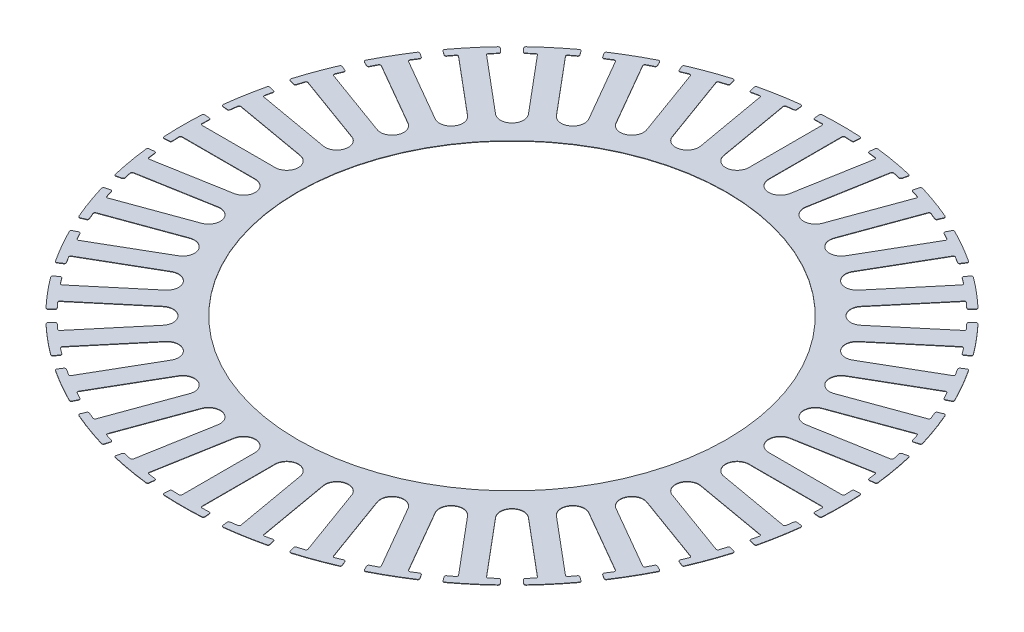
from build123d import *

# Parameters (mm, degrees)
P_IDAT_VYSUNUT_M1_DEPTH = 0.05
ZAOBLIT1_R              = 0.2
KRUHOV_POLE1_DEPTH      = 0.05


# Read off the part's stored shape, not the designer's step: Kruhové pole1
with BuildPart() as part:
    # Skica1 → Přidat vysunutím1 (new body)
    with BuildSketch(Plane(origin=(0, 0, 0), x_dir=(1, 0, 0), z_dir=(0, 1, 0))):
        with BuildLine():
            Line((-2.569801004, 41.420358796), (-2.507878089, 40.422277861))
            ThreePointArc((-2.507878089, 40.422277861), (-1.879166138, 40.456380642), (-1.25, 40.48070528))
            Line((-1.25, 40.48070528), (-1.25, 31.073947021))
            Line((-1.25, 31.073947021), (-1.085241159, 26.978181029))
            ThreePointArc((-1.085241159, 26.978181029), (1.270191917, 26.970105904), (3.615958065, 26.756771989))
            Line((3.615958065, 26.756771989), (4.164924582, 30.818924165))
            ThreePointArc((4.164924582, 30.818924165), (2.590619594, 29.610917461), (1.25, 31.073947021))
            Line((1.25, 31.073947021), (1.25, 40.48070528))
            ThreePointArc((1.25, 40.48070528), (1.879166138, 40.456380642), (2.507878089, 40.422277861))
            Line((2.507878089, 40.422277861), (2.569801004, 41.420358796))
            ThreePointArc((2.569801004, 41.420358796), (0, 41.5), (-2.569801004, 41.420358796))
        make_face()
    extrude(amount=P_IDAT_VYSUNUT_M1_DEPTH)

    # Zaoblit1
    zaoblit1_edges = [part.edges().sort_by_distance(p)[0] for p in [
        (-2.507878089, 0.025, -40.422277861),
        (-2.569801004, 0.025, -41.420358796),
        (2.569801004, 0.025, -41.420358796),
        (2.507878089, 0.025, -40.422277861),
        (1.25, 0.025, -40.48070528),
        (-1.25, 0.025, -40.48070528),
    ]]
    fillet(zaoblit1_edges, radius=ZAOBLIT1_R)

    # Kruhové pole1 outline → Kruhové pole1 (add)
    with BuildSketch(Plane(origin=(0, 0, 0), x_dir=(1, 0, 0), z_dir=(0, 1, 0))):
        with BuildLine():
            ThreePointArc((-9.535776959, 39.566639455), (-9.446113134, 39.443136268), (-9.295440541, 39.418837948))
            ThreePointArc((-9.295440541, 39.418837948), (-8.879840332, 39.514534486), (-8.463255471, 39.605849402))
            ThreePointArc((-8.463255471, 39.605849402), (-8.309712699, 39.576132918), (-8.224500066, 39.444994596))
            Line((-8.224500066, 39.444994596), (-6.626943964, 30.384803721))
            ThreePointArc((-6.626943964, 30.384803721), (-7.693144117, 28.711204717), (-9.453300038, 29.627483893))
            Line((-9.453300038, 29.627483893), (-12.599871307, 38.272617405))
            ThreePointArc((-12.599871307, 38.272617405), (-12.591644164, 38.42879284), (-12.473530464, 38.531299456))
            ThreePointArc((-12.473530464, 38.531299456), (-12.067099933, 38.66051085), (-11.659331326, 38.785435321))
            ThreePointArc((-11.659331326, 38.785435321), (-11.540994193, 38.88181458), (-11.525094636, 39.03360339))
            Line((-11.525094636, 39.03360339), (-11.695001824, 39.609051142))
            ThreePointArc((-11.695001824, 39.609051142), (-11.791655425, 39.728326768), (-11.94437873, 39.74395321))
            ThreePointArc((-11.94437873, 39.74395321), (-14.193835948, 38.997243763), (-16.396995731, 38.123333157))
            ThreePointArc((-16.396995731, 38.123333157), (-16.503944086, 38.01319396), (-16.501316146, 37.859695792))
            Line((-16.501316146, 37.859695792), (-16.261581918, 37.309663005))
            ThreePointArc((-16.261581918, 37.309663005), (-16.151834185, 37.203606068), (-15.999231288, 37.205840915))
            ThreePointArc((-15.999231288, 37.205840915), (-15.60656251, 37.372251827), (-15.212163177, 37.534518666))
            ThreePointArc((-15.212163177, 37.534518666), (-15.055792851, 37.531916065), (-14.949102859, 37.417567047))
            Line((-14.949102859, 37.417567047), (-11.80253159, 28.772433535))
            ThreePointArc((-11.80253159, 28.772433535), (-12.56191635, 26.939116547), (-14.454441756, 27.535827516))
            Line((-14.454441756, 27.535827516), (-19.054421217, 35.503225657))
            ThreePointArc((-19.054421217, 35.503225657), (-19.073438642, 35.658457064), (-18.974919442, 35.779916603))
            ThreePointArc((-18.974919442, 35.779916603), (-18.597100828, 35.977740907), (-18.217220048, 36.17157577))
            ThreePointArc((-18.217220048, 36.17157577), (-18.117416804, 36.28703984), (-18.128116648, 36.439283566))
            Line((-18.128116648, 36.439283566), (-18.395368018, 36.976484899))
            ThreePointArc((-18.395368018, 36.976484899), (-18.511265228, 37.077164739), (-18.664381826, 37.066033657))
            ThreePointArc((-18.664381826, 37.066033657), (-20.75, 35.940054257), (-22.767935851, 34.696845636))
            ThreePointArc((-22.767935851, 34.696845636), (-22.85413395, 34.569808313), (-22.824891256, 34.419098465))
            Line((-22.824891256, 34.419098465), (-22.493286939, 33.919051323))
            ThreePointArc((-22.493286939, 33.919051323), (-22.366789927, 33.833663123), (-22.216893488, 33.862363233))
            ThreePointArc((-22.216893488, 33.862363233), (-21.859087183, 34.094432207), (-21.498857003, 34.322720574))
            ThreePointArc((-21.498857003, 34.322720574), (-21.344410357, 34.347310934), (-21.219484727, 34.253225657))
            Line((-21.219484727, 34.253225657), (-16.619505265, 26.285827516))
            ThreePointArc((-16.619505265, 26.285827516), (-17.049001111, 24.348496953), (-19.016392575, 24.607508953))
            Line((-19.016392575, 24.607508953), (-24.930012181, 31.655086363))
            ThreePointArc((-24.930012181, 31.655086363), (-24.975696339, 31.804657116), (-24.899765095, 31.941379091))
            ThreePointArc((-24.899765095, 31.941379091), (-24.562038224, 32.201805513), (-24.221587758, 32.458661194))
            ThreePointArc((-24.221587758, 32.458661194), (-24.143350875, 32.589701756), (-24.180325009, 32.737774549))
            Line((-24.180325009, 32.737774549), (-24.536800263, 33.220406874))
            ThreePointArc((-24.536800263, 33.220406874), (-24.668419605, 33.299431821), (-24.817277126, 33.261881427))
            ThreePointArc((-24.817277126, 33.261881427), (-26.675685802, 31.790844389), (-28.447083762, 30.216112018))
            ThreePointArc((-28.447083762, 30.216112018), (-28.509912518, 30.076036535), (-28.454943596, 29.932694248))
            Line((-28.454943596, 29.932694248), (-28.041544819, 29.497826431))
            ThreePointArc((-28.041544819, 29.497826431), (-27.902142075, 29.435701446), (-27.759506622, 29.48999478))
            ThreePointArc((-27.759506622, 29.48999478), (-27.447434553, 29.780670518), (-27.132318937, 30.068043985))
            ThreePointArc((-27.132318937, 30.068043985), (-26.984488754, 30.119080141), (-26.845123288, 30.048117339))
            Line((-26.845123288, 30.048117339), (-20.931503683, 23.000539929))
            ThreePointArc((-20.931503683, 23.000539929), (-21.0180606, 21.0180606), (-23.000539929, 20.931503683))
            Line((-23.000539929, 20.931503683), (-30.048117339, 26.845123288))
            ThreePointArc((-30.048117339, 26.845123288), (-30.119080141, 26.984488754), (-30.068043985, 27.132318937))
            ThreePointArc((-30.068043985, 27.132318937), (-29.780670518, 27.447434553), (-29.48999478, 27.759506622))
            ThreePointArc((-29.48999478, 27.759506622), (-29.435701446, 27.902142075), (-29.497826431, 28.041544819))
            Line((-29.497826431, 28.041544819), (-29.932694248, 28.454943596))
            ThreePointArc((-29.932694248, 28.454943596), (-30.076036535, 28.509912518), (-30.216112018, 28.447083762))
            ThreePointArc((-30.216112018, 28.447083762), (-31.790844389, 26.675685802), (-33.261881427, 24.817277126))
            ThreePointArc((-33.261881427, 24.817277126), (-33.299431821, 24.668419605), (-33.220406874, 24.536800263))
            Line((-33.220406874, 24.536800263), (-32.737774549, 24.180325009))
            ThreePointArc((-32.737774549, 24.180325009), (-32.589701756, 24.143350875), (-32.458661194, 24.221587758))
            ThreePointArc((-32.458661194, 24.221587758), (-32.201805513, 24.562038224), (-31.941379091, 24.899765095))
            ThreePointArc((-31.941379091, 24.899765095), (-31.804657116, 24.975696339), (-31.655086363, 24.930012181))
            Line((-31.655086363, 24.930012181), (-24.607508953, 19.016392575))
            ThreePointArc((-24.607508953, 19.016392575), (-24.348496953, 17.049001111), (-26.285827516, 16.619505265))
            Line((-26.285827516, 16.619505265), (-34.253225657, 21.219484727))
            ThreePointArc((-34.253225657, 21.219484727), (-34.347310934, 21.344410357), (-34.322720574, 21.498857003))
            ThreePointArc((-34.322720574, 21.498857003), (-34.094432207, 21.859087183), (-33.862363233, 22.216893488))
            ThreePointArc((-33.862363233, 22.216893488), (-33.833663123, 22.366789927), (-33.919051323, 22.493286939))
            Line((-33.919051323, 22.493286939), (-34.419098465, 22.824891256))
            ThreePointArc((-34.419098465, 22.824891256), (-34.569808313, 22.85413395), (-34.696845636, 22.767935851))
            ThreePointArc((-34.696845636, 22.767935851), (-35.940054257, 20.75), (-37.066033657, 18.664381826))
            ThreePointArc((-37.066033657, 18.664381826), (-37.077164739, 18.511265228), (-36.976484899, 18.395368018))
            Line((-36.976484899, 18.395368018), (-36.439283566, 18.128116648))
            ThreePointArc((-36.439283566, 18.128116648), (-36.28703984, 18.117416804), (-36.17157577, 18.217220048))
            ThreePointArc((-36.17157577, 18.217220048), (-35.977740907, 18.597100828), (-35.779916603, 18.974919442))
            ThreePointArc((-35.779916603, 18.974919442), (-35.658457064, 19.073438642), (-35.503225657, 19.054421217))
            Line((-35.503225657, 19.054421217), (-27.535827516, 14.454441756))
            ThreePointArc((-27.535827516, 14.454441756), (-26.939116547, 12.56191635), (-28.772433535, 11.80253159))
            Line((-28.772433535, 11.80253159), (-37.417567047, 14.949102859))
            ThreePointArc((-37.417567047, 14.949102859), (-37.531916065, 15.055792851), (-37.534518666, 15.212163177))
            ThreePointArc((-37.534518666, 15.212163177), (-37.372251827, 15.60656251), (-37.205840915, 15.999231288))
            ThreePointArc((-37.205840915, 15.999231288), (-37.203606068, 16.151834185), (-37.309663005, 16.261581918))
            Line((-37.309663005, 16.261581918), (-37.859695792, 16.501316146))
            ThreePointArc((-37.859695792, 16.501316146), (-38.01319396, 16.503944086), (-38.123333157, 16.396995731))
            ThreePointArc((-38.123333157, 16.396995731), (-38.997243763, 14.193835948), (-39.74395321, 11.94437873))
            ThreePointArc((-39.74395321, 11.94437873), (-39.728326768, 11.791655425), (-39.609051142, 11.695001824))
            Line((-39.609051142, 11.695001824), (-39.03360339, 11.525094636))
            ThreePointArc((-39.03360339, 11.525094636), (-38.88181458, 11.540994193), (-38.785435321, 11.659331326))
            ThreePointArc((-38.785435321, 11.659331326), (-38.66051085, 12.067099933), (-38.531299456, 12.473530464))
            ThreePointArc((-38.531299456, 12.473530464), (-38.42879284, 12.591644164), (-38.272617405, 12.599871307))
            Line((-38.272617405, 12.599871307), (-29.627483893, 9.453300038))
            ThreePointArc((-29.627483893, 9.453300038), (-28.711204717, 7.693144117), (-30.384803721, 6.626943964))
            Line((-30.384803721, 6.626943964), (-39.444994596, 8.224500066))
            ThreePointArc((-39.444994596, 8.224500066), (-39.576132918, 8.309712699), (-39.605849402, 8.463255471))
            ThreePointArc((-39.605849402, 8.463255471), (-39.514534486, 8.879840332), (-39.418837948, 9.295440541))
            ThreePointArc((-39.418837948, 9.295440541), (-39.443136268, 9.446113134), (-39.566639455, 9.535776959))
            Line((-39.566639455, 9.535776959), (-40.14994542, 9.676356894))
            ThreePointArc((-40.14994542, 9.676356894), (-40.301567943, 9.652290233), (-40.391462492, 9.527841192))
            ThreePointArc((-40.391462492, 9.527841192), (-40.86952175, 7.206399373), (-41.214272856, 4.86145173))
            ThreePointArc((-41.214272856, 4.86145173), (-41.172363691, 4.713762138), (-41.038116408, 4.639288918))
            Line((-41.038116408, 4.639288918), (-40.441906928, 4.571888455))
            ThreePointArc((-40.441906928, 4.571888455), (-40.29518506, 4.613904312), (-40.220819046, 4.747179721))
            ThreePointArc((-40.220819046, 4.747179721), (-40.168600734, 5.170446314), (-40.111928272, 5.593139575))
            ThreePointArc((-40.111928272, 5.593139575), (-40.03148919, 5.727258949), (-39.87911504, 5.762480683))
            Line((-39.87911504, 5.762480683), (-30.818924165, 4.164924582))
            ThreePointArc((-30.818924165, 4.164924582), (-29.610917461, 2.590619594), (-31.073947021, 1.25))
            Line((-31.073947021, 1.25), (-40.273905944, 1.25))
            ThreePointArc((-40.273905944, 1.25), (-40.417848999, 1.311146131), (-40.473776445, 1.45719603))
            ThreePointArc((-40.473776445, 1.45719603), (-40.45618801, 1.8833087), (-40.434113536, 2.309212537))
            ThreePointArc((-40.434113536, 2.309212537), (-40.484206732, 2.453376716), (-40.621403588, 2.520232243))
            Line((-40.621403588, 2.520232243), (-41.220259274, 2.557386434))
            ThreePointArc((-41.220259274, 2.557386434), (-41.365399178, 2.507356425), (-41.432317677, 2.369188021))
            ThreePointArc((-41.432317677, 2.369188021), (-41.5, 0), (-41.432317677, -2.369188021))
            ThreePointArc((-41.432317677, -2.369188021), (-41.365399178, -2.507356425), (-41.220259274, -2.557386434))
            Line((-41.220259274, -2.557386434), (-40.621403588, -2.520232243))
            ThreePointArc((-40.621403588, -2.520232243), (-40.484206732, -2.453376716), (-40.434113536, -2.309212537))
            ThreePointArc((-40.434113536, -2.309212537), (-40.45618801, -1.8833087), (-40.473776445, -1.45719603))
            ThreePointArc((-40.473776445, -1.45719603), (-40.417848999, -1.311146131), (-40.273905944, -1.25))
            Line((-40.273905944, -1.25), (-31.073947021, -1.25))
            ThreePointArc((-31.073947021, -1.25), (-29.610917461, -2.590619594), (-30.818924165, -4.164924582))
            Line((-30.818924165, -4.164924582), (-39.87911504, -5.762480683))
            ThreePointArc((-39.87911504, -5.762480683), (-40.03148919, -5.727258949), (-40.111928272, -5.593139575))
            ThreePointArc((-40.111928272, -5.593139575), (-40.168600734, -5.170446314), (-40.220819046, -4.747179721))
            ThreePointArc((-40.220819046, -4.747179721), (-40.29518506, -4.613904312), (-40.441906928, -4.571888455))
            Line((-40.441906928, -4.571888455), (-41.038116408, -4.639288918))
            ThreePointArc((-41.038116408, -4.639288918), (-41.172363691, -4.713762138), (-41.214272856, -4.86145173))
            ThreePointArc((-41.214272856, -4.86145173), (-40.86952175, -7.206399373), (-40.391462492, -9.527841192))
            ThreePointArc((-40.391462492, -9.527841192), (-40.301567943, -9.652290233), (-40.14994542, -9.676356894))
            Line((-40.14994542, -9.676356894), (-39.566639455, -9.535776959))
            ThreePointArc((-39.566639455, -9.535776959), (-39.443136268, -9.446113134), (-39.418837948, -9.295440541))
            ThreePointArc((-39.418837948, -9.295440541), (-39.514534486, -8.879840332), (-39.605849402, -8.463255471))
            ThreePointArc((-39.605849402, -8.463255471), (-39.576132918, -8.309712699), (-39.444994596, -8.224500066))
            Line((-39.444994596, -8.224500066), (-30.384803721, -6.626943964))
            ThreePointArc((-30.384803721, -6.626943964), (-28.711204717, -7.693144117), (-29.627483893, -9.453300038))
            Line((-29.627483893, -9.453300038), (-38.272617405, -12.599871307))
            ThreePointArc((-38.272617405, -12.599871307), (-38.42879284, -12.591644164), (-38.531299456, -12.473530464))
            ThreePointArc((-38.531299456, -12.473530464), (-38.66051085, -12.067099933), (-38.785435321, -11.659331326))
            ThreePointArc((-38.785435321, -11.659331326), (-38.88181458, -11.540994193), (-39.03360339, -11.525094636))
            Line((-39.03360339, -11.525094636), (-39.609051142, -11.695001824))
            ThreePointArc((-39.609051142, -11.695001824), (-39.728326768, -11.791655425), (-39.74395321, -11.94437873))
            ThreePointArc((-39.74395321, -11.94437873), (-38.997243763, -14.193835948), (-38.123333157, -16.396995731))
            ThreePointArc((-38.123333157, -16.396995731), (-38.01319396, -16.503944086), (-37.859695792, -16.501316146))
            Line((-37.859695792, -16.501316146), (-37.309663005, -16.261581918))
            ThreePointArc((-37.309663005, -16.261581918), (-37.203606068, -16.151834185), (-37.205840915, -15.999231288))
            ThreePointArc((-37.205840915, -15.999231288), (-37.372251827, -15.60656251), (-37.534518666, -15.212163177))
            ThreePointArc((-37.534518666, -15.212163177), (-37.531916065, -15.055792851), (-37.417567047, -14.949102859))
            Line((-37.417567047, -14.949102859), (-28.772433535, -11.80253159))
            ThreePointArc((-28.772433535, -11.80253159), (-26.939116547, -12.56191635), (-27.535827516, -14.454441756))
            Line((-27.535827516, -14.454441756), (-35.503225657, -19.054421217))
            ThreePointArc((-35.503225657, -19.054421217), (-35.658457064, -19.073438642), (-35.779916603, -18.974919442))
            ThreePointArc((-35.779916603, -18.974919442), (-35.977740907, -18.597100828), (-36.17157577, -18.217220048))
            ThreePointArc((-36.17157577, -18.217220048), (-36.28703984, -18.117416804), (-36.439283566, -18.128116648))
            Line((-36.439283566, -18.128116648), (-36.976484899, -18.395368018))
            ThreePointArc((-36.976484899, -18.395368018), (-37.077164739, -18.511265228), (-37.066033657, -18.664381826))
            ThreePointArc((-37.066033657, -18.664381826), (-35.940054257, -20.75), (-34.696845636, -22.767935851))
            ThreePointArc((-34.696845636, -22.767935851), (-34.569808313, -22.85413395), (-34.419098465, -22.824891256))
            Line((-34.419098465, -22.824891256), (-33.919051323, -22.493286939))
            ThreePointArc((-33.919051323, -22.493286939), (-33.833663123, -22.366789927), (-33.862363233, -22.216893488))
            ThreePointArc((-33.862363233, -22.216893488), (-34.094432207, -21.859087183), (-34.322720574, -21.498857003))
            ThreePointArc((-34.322720574, -21.498857003), (-34.347310934, -21.344410357), (-34.253225657, -21.219484727))
            Line((-34.253225657, -21.219484727), (-26.285827516, -16.619505265))
            ThreePointArc((-26.285827516, -16.619505265), (-24.348496953, -17.049001111), (-24.607508953, -19.016392575))
            Line((-24.607508953, -19.016392575), (-31.655086363, -24.930012181))
            ThreePointArc((-31.655086363, -24.930012181), (-31.804657116, -24.975696339), (-31.941379091, -24.899765095))
            ThreePointArc((-31.941379091, -24.899765095), (-32.201805513, -24.562038224), (-32.458661194, -24.221587758))
            ThreePointArc((-32.458661194, -24.221587758), (-32.589701756, -24.143350875), (-32.737774549, -24.180325009))
            Line((-32.737774549, -24.180325009), (-33.220406874, -24.536800263))
            ThreePointArc((-33.220406874, -24.536800263), (-33.299431821, -24.668419605), (-33.261881427, -24.817277126))
            ThreePointArc((-33.261881427, -24.817277126), (-31.790844389, -26.675685802), (-30.216112018, -28.447083762))
            ThreePointArc((-30.216112018, -28.447083762), (-30.076036535, -28.509912518), (-29.932694248, -28.454943596))
            Line((-29.932694248, -28.454943596), (-29.497826431, -28.041544819))
            ThreePointArc((-29.497826431, -28.041544819), (-29.435701446, -27.902142075), (-29.48999478, -27.759506622))
            ThreePointArc((-29.48999478, -27.759506622), (-29.780670518, -27.447434553), (-30.068043985, -27.132318937))
            ThreePointArc((-30.068043985, -27.132318937), (-30.119080141, -26.984488754), (-30.048117339, -26.845123288))
            Line((-30.048117339, -26.845123288), (-23.000539929, -20.931503683))
            ThreePointArc((-23.000539929, -20.931503683), (-21.0180606, -21.0180606), (-20.931503683, -23.000539929))
            Line((-20.931503683, -23.000539929), (-26.845123288, -30.048117339))
            ThreePointArc((-26.845123288, -30.048117339), (-26.984488754, -30.119080141), (-27.132318937, -30.068043985))
            ThreePointArc((-27.132318937, -30.068043985), (-27.447434553, -29.780670518), (-27.759506622, -29.48999478))
            ThreePointArc((-27.759506622, -29.48999478), (-27.902142075, -29.435701446), (-28.041544819, -29.497826431))
            Line((-28.041544819, -29.497826431), (-28.454943596, -29.932694248))
            ThreePointArc((-28.454943596, -29.932694248), (-28.509912518, -30.076036535), (-28.447083762, -30.216112018))
            ThreePointArc((-28.447083762, -30.216112018), (-26.675685802, -31.790844389), (-24.817277126, -33.261881427))
            ThreePointArc((-24.817277126, -33.261881427), (-24.668419605, -33.299431821), (-24.536800263, -33.220406874))
            Line((-24.536800263, -33.220406874), (-24.180325009, -32.737774549))
            ThreePointArc((-24.180325009, -32.737774549), (-24.143350875, -32.589701756), (-24.221587758, -32.458661194))
            ThreePointArc((-24.221587758, -32.458661194), (-24.562038224, -32.201805513), (-24.899765095, -31.941379091))
            ThreePointArc((-24.899765095, -31.941379091), (-24.975696339, -31.804657116), (-24.930012181, -31.655086363))
            Line((-24.930012181, -31.655086363), (-19.016392575, -24.607508953))
            ThreePointArc((-19.016392575, -24.607508953), (-17.049001111, -24.348496953), (-16.619505265, -26.285827516))
            Line((-16.619505265, -26.285827516), (-21.219484727, -34.253225657))
            ThreePointArc((-21.219484727, -34.253225657), (-21.344410357, -34.347310934), (-21.498857003, -34.322720574))
            ThreePointArc((-21.498857003, -34.322720574), (-21.859087183, -34.094432207), (-22.216893488, -33.862363233))
            ThreePointArc((-22.216893488, -33.862363233), (-22.366789927, -33.833663123), (-22.493286939, -33.919051323))
            Line((-22.493286939, -33.919051323), (-22.824891256, -34.419098465))
            ThreePointArc((-22.824891256, -34.419098465), (-22.85413395, -34.569808313), (-22.767935851, -34.696845636))
            ThreePointArc((-22.767935851, -34.696845636), (-20.75, -35.940054257), (-18.664381826, -37.066033657))
            ThreePointArc((-18.664381826, -37.066033657), (-18.511265228, -37.077164739), (-18.395368018, -36.976484899))
            Line((-18.395368018, -36.976484899), (-18.128116648, -36.439283566))
            ThreePointArc((-18.128116648, -36.439283566), (-18.117416804, -36.28703984), (-18.217220048, -36.17157577))
            ThreePointArc((-18.217220048, -36.17157577), (-18.597100828, -35.977740907), (-18.974919442, -35.779916603))
            ThreePointArc((-18.974919442, -35.779916603), (-19.073438642, -35.658457064), (-19.054421217, -35.503225657))
            Line((-19.054421217, -35.503225657), (-14.454441756, -27.535827516))
            ThreePointArc((-14.454441756, -27.535827516), (-12.56191635, -26.939116547), (-11.80253159, -28.772433535))
            Line((-11.80253159, -28.772433535), (-14.949102859, -37.417567047))
            ThreePointArc((-14.949102859, -37.417567047), (-15.055792851, -37.531916065), (-15.212163177, -37.534518666))
            ThreePointArc((-15.212163177, -37.534518666), (-15.60656251, -37.372251827), (-15.999231288, -37.205840915))
            ThreePointArc((-15.999231288, -37.205840915), (-16.151834185, -37.203606068), (-16.261581918, -37.309663005))
            Line((-16.261581918, -37.309663005), (-16.501316146, -37.859695792))
            ThreePointArc((-16.501316146, -37.859695792), (-16.503944086, -38.01319396), (-16.396995731, -38.123333157))
            ThreePointArc((-16.396995731, -38.123333157), (-14.193835948, -38.997243763), (-11.94437873, -39.74395321))
            ThreePointArc((-11.94437873, -39.74395321), (-11.791655425, -39.728326768), (-11.695001824, -39.609051142))
            Line((-11.695001824, -39.609051142), (-11.525094636, -39.03360339))
            ThreePointArc((-11.525094636, -39.03360339), (-11.540994193, -38.88181458), (-11.659331326, -38.785435321))
            ThreePointArc((-11.659331326, -38.785435321), (-12.067099933, -38.66051085), (-12.473530464, -38.531299456))
            ThreePointArc((-12.473530464, -38.531299456), (-12.591644164, -38.42879284), (-12.599871307, -38.272617405))
            Line((-12.599871307, -38.272617405), (-9.453300038, -29.627483893))
            ThreePointArc((-9.453300038, -29.627483893), (-7.693144117, -28.711204717), (-6.626943964, -30.384803721))
            Line((-6.626943964, -30.384803721), (-8.224500066, -39.444994596))
            ThreePointArc((-8.224500066, -39.444994596), (-8.309712699, -39.576132918), (-8.463255471, -39.605849402))
            ThreePointArc((-8.463255471, -39.605849402), (-8.879840332, -39.514534486), (-9.295440541, -39.418837948))
            ThreePointArc((-9.295440541, -39.418837948), (-9.446113134, -39.443136268), (-9.535776959, -39.566639455))
            Line((-9.535776959, -39.566639455), (-9.676356894, -40.14994542))
            ThreePointArc((-9.676356894, -40.14994542), (-9.652290233, -40.301567943), (-9.527841192, -40.391462492))
            ThreePointArc((-9.527841192, -40.391462492), (-7.206399373, -40.86952175), (-4.86145173, -41.214272856))
            ThreePointArc((-4.86145173, -41.214272856), (-4.713762138, -41.172363691), (-4.639288918, -41.038116408))
            Line((-4.639288918, -41.038116408), (-4.571888455, -40.441906928))
            ThreePointArc((-4.571888455, -40.441906928), (-4.613904312, -40.29518506), (-4.747179721, -40.220819046))
            ThreePointArc((-4.747179721, -40.220819046), (-5.170446314, -40.168600734), (-5.593139575, -40.111928272))
            ThreePointArc((-5.593139575, -40.111928272), (-5.727258949, -40.03148919), (-5.762480683, -39.87911504))
            Line((-5.762480683, -39.87911504), (-4.164924582, -30.818924165))
            ThreePointArc((-4.164924582, -30.818924165), (-2.590619594, -29.610917461), (-1.25, -31.073947021))
            Line((-1.25, -31.073947021), (-1.25, -40.273905944))
            ThreePointArc((-1.25, -40.273905944), (-1.311146131, -40.417848999), (-1.45719603, -40.473776445))
            ThreePointArc((-1.45719603, -40.473776445), (-1.8833087, -40.45618801), (-2.309212537, -40.434113536))
            ThreePointArc((-2.309212537, -40.434113536), (-2.453376716, -40.484206732), (-2.520232243, -40.621403588))
            Line((-2.520232243, -40.621403588), (-2.557386434, -41.220259274))
            ThreePointArc((-2.557386434, -41.220259274), (-2.507356425, -41.365399178), (-2.369188021, -41.432317677))
            ThreePointArc((-2.369188021, -41.432317677), (0, -41.5), (2.369188021, -41.432317677))
            ThreePointArc((2.369188021, -41.432317677), (2.507356425, -41.365399178), (2.557386434, -41.220259274))
            Line((2.557386434, -41.220259274), (2.520232243, -40.621403588))
            ThreePointArc((2.520232243, -40.621403588), (2.453376716, -40.484206732), (2.309212537, -40.434113536))
            ThreePointArc((2.309212537, -40.434113536), (1.8833087, -40.45618801), (1.45719603, -40.473776445))
            ThreePointArc((1.45719603, -40.473776445), (1.311146131, -40.417848999), (1.25, -40.273905944))
            Line((1.25, -40.273905944), (1.25, -31.073947021))
            ThreePointArc((1.25, -31.073947021), (2.590619594, -29.610917461), (4.164924582, -30.818924165))
            Line((4.164924582, -30.818924165), (5.762480683, -39.87911504))
            ThreePointArc((5.762480683, -39.87911504), (5.727258949, -40.03148919), (5.593139575, -40.111928272))
            ThreePointArc((5.593139575, -40.111928272), (5.170446314, -40.168600734), (4.747179721, -40.220819046))
            ThreePointArc((4.747179721, -40.220819046), (4.613904312, -40.29518506), (4.571888455, -40.441906928))
            Line((4.571888455, -40.441906928), (4.639288918, -41.038116408))
            ThreePointArc((4.639288918, -41.038116408), (4.713762138, -41.172363691), (4.86145173, -41.214272856))
            ThreePointArc((4.86145173, -41.214272856), (7.206399373, -40.86952175), (9.527841192, -40.391462492))
            ThreePointArc((9.527841192, -40.391462492), (9.652290233, -40.301567943), (9.676356894, -40.14994542))
            Line((9.676356894, -40.14994542), (9.535776959, -39.566639455))
            ThreePointArc((9.535776959, -39.566639455), (9.446113134, -39.443136268), (9.295440541, -39.418837948))
            ThreePointArc((9.295440541, -39.418837948), (8.879840332, -39.514534486), (8.463255471, -39.605849402))
            ThreePointArc((8.463255471, -39.605849402), (8.309712699, -39.576132918), (8.224500066, -39.444994596))
            Line((8.224500066, -39.444994596), (6.626943964, -30.384803721))
            ThreePointArc((6.626943964, -30.384803721), (7.693144117, -28.711204717), (9.453300038, -29.627483893))
            Line((9.453300038, -29.627483893), (12.599871307, -38.272617405))
            ThreePointArc((12.599871307, -38.272617405), (12.591644164, -38.42879284), (12.473530464, -38.531299456))
            ThreePointArc((12.473530464, -38.531299456), (12.067099933, -38.66051085), (11.659331326, -38.785435321))
            ThreePointArc((11.659331326, -38.785435321), (11.540994193, -38.88181458), (11.525094636, -39.03360339))
            Line((11.525094636, -39.03360339), (11.695001824, -39.609051142))
            ThreePointArc((11.695001824, -39.609051142), (11.791655425, -39.728326768), (11.94437873, -39.74395321))
            ThreePointArc((11.94437873, -39.74395321), (14.193835948, -38.997243763), (16.396995731, -38.123333157))
            ThreePointArc((16.396995731, -38.123333157), (16.503944086, -38.01319396), (16.501316146, -37.859695792))
            Line((16.501316146, -37.859695792), (16.261581918, -37.309663005))
            ThreePointArc((16.261581918, -37.309663005), (16.151834185, -37.203606068), (15.999231288, -37.205840915))
            ThreePointArc((15.999231288, -37.205840915), (15.60656251, -37.372251827), (15.212163177, -37.534518666))
            ThreePointArc((15.212163177, -37.534518666), (15.055792851, -37.531916065), (14.949102859, -37.417567047))
            Line((14.949102859, -37.417567047), (11.80253159, -28.772433535))
            ThreePointArc((11.80253159, -28.772433535), (12.56191635, -26.939116547), (14.454441756, -27.535827516))
            Line((14.454441756, -27.535827516), (19.054421217, -35.503225657))
            ThreePointArc((19.054421217, -35.503225657), (19.073438642, -35.658457064), (18.974919442, -35.779916603))
            ThreePointArc((18.974919442, -35.779916603), (18.597100828, -35.977740907), (18.217220048, -36.17157577))
            ThreePointArc((18.217220048, -36.17157577), (18.117416804, -36.28703984), (18.128116648, -36.439283566))
            Line((18.128116648, -36.439283566), (18.395368018, -36.976484899))
            ThreePointArc((18.395368018, -36.976484899), (18.511265228, -37.077164739), (18.664381826, -37.066033657))
            ThreePointArc((18.664381826, -37.066033657), (20.75, -35.940054257), (22.767935851, -34.696845636))
            ThreePointArc((22.767935851, -34.696845636), (22.85413395, -34.569808313), (22.824891256, -34.419098465))
            Line((22.824891256, -34.419098465), (22.493286939, -33.919051323))
            ThreePointArc((22.493286939, -33.919051323), (22.366789927, -33.833663123), (22.216893488, -33.862363233))
            ThreePointArc((22.216893488, -33.862363233), (21.859087183, -34.094432207), (21.498857003, -34.322720574))
            ThreePointArc((21.498857003, -34.322720574), (21.344410357, -34.347310934), (21.219484727, -34.253225657))
            Line((21.219484727, -34.253225657), (16.619505265, -26.285827516))
            ThreePointArc((16.619505265, -26.285827516), (17.049001111, -24.348496953), (19.016392575, -24.607508953))
            Line((19.016392575, -24.607508953), (24.930012181, -31.655086363))
            ThreePointArc((24.930012181, -31.655086363), (24.975696339, -31.804657116), (24.899765095, -31.941379091))
            ThreePointArc((24.899765095, -31.941379091), (24.562038224, -32.201805513), (24.221587758, -32.458661194))
            ThreePointArc((24.221587758, -32.458661194), (24.143350875, -32.589701756), (24.180325009, -32.737774549))
            Line((24.180325009, -32.737774549), (24.536800263, -33.220406874))
            ThreePointArc((24.536800263, -33.220406874), (24.668419605, -33.299431821), (24.817277126, -33.261881427))
            ThreePointArc((24.817277126, -33.261881427), (26.675685802, -31.790844389), (28.447083762, -30.216112018))
            ThreePointArc((28.447083762, -30.216112018), (28.509912518, -30.076036535), (28.454943596, -29.932694248))
            Line((28.454943596, -29.932694248), (28.041544819, -29.497826431))
            ThreePointArc((28.041544819, -29.497826431), (27.902142075, -29.435701446), (27.759506622, -29.48999478))
            ThreePointArc((27.759506622, -29.48999478), (27.447434553, -29.780670518), (27.132318937, -30.068043985))
            ThreePointArc((27.132318937, -30.068043985), (26.984488754, -30.119080141), (26.845123288, -30.048117339))
            Line((26.845123288, -30.048117339), (20.931503683, -23.000539929))
            ThreePointArc((20.931503683, -23.000539929), (21.0180606, -21.0180606), (23.000539929, -20.931503683))
            Line((23.000539929, -20.931503683), (30.048117339, -26.845123288))
            ThreePointArc((30.048117339, -26.845123288), (30.119080141, -26.984488754), (30.068043985, -27.132318937))
            ThreePointArc((30.068043985, -27.132318937), (29.780670518, -27.447434553), (29.48999478, -27.759506622))
            ThreePointArc((29.48999478, -27.759506622), (29.435701446, -27.902142075), (29.497826431, -28.041544819))
            Line((29.497826431, -28.041544819), (29.932694248, -28.454943596))
            ThreePointArc((29.932694248, -28.454943596), (30.076036535, -28.509912518), (30.216112018, -28.447083762))
            ThreePointArc((30.216112018, -28.447083762), (31.790844389, -26.675685802), (33.261881427, -24.817277126))
            ThreePointArc((33.261881427, -24.817277126), (33.299431821, -24.668419605), (33.220406874, -24.536800263))
            Line((33.220406874, -24.536800263), (32.737774549, -24.180325009))
            ThreePointArc((32.737774549, -24.180325009), (32.589701756, -24.143350875), (32.458661194, -24.221587758))
            ThreePointArc((32.458661194, -24.221587758), (32.201805513, -24.562038224), (31.941379091, -24.899765095))
            ThreePointArc((31.941379091, -24.899765095), (31.804657116, -24.975696339), (31.655086363, -24.930012181))
            Line((31.655086363, -24.930012181), (24.607508953, -19.016392575))
            ThreePointArc((24.607508953, -19.016392575), (24.348496953, -17.049001111), (26.285827516, -16.619505265))
            Line((26.285827516, -16.619505265), (34.253225657, -21.219484727))
            ThreePointArc((34.253225657, -21.219484727), (34.347310934, -21.344410357), (34.322720574, -21.498857003))
            ThreePointArc((34.322720574, -21.498857003), (34.094432207, -21.859087183), (33.862363233, -22.216893488))
            ThreePointArc((33.862363233, -22.216893488), (33.833663123, -22.366789927), (33.919051323, -22.493286939))
            Line((33.919051323, -22.493286939), (34.419098465, -22.824891256))
            ThreePointArc((34.419098465, -22.824891256), (34.569808313, -22.85413395), (34.696845636, -22.767935851))
            ThreePointArc((34.696845636, -22.767935851), (35.940054257, -20.75), (37.066033657, -18.664381826))
            ThreePointArc((37.066033657, -18.664381826), (37.077164739, -18.511265228), (36.976484899, -18.395368018))
            Line((36.976484899, -18.395368018), (36.439283566, -18.128116648))
            ThreePointArc((36.439283566, -18.128116648), (36.28703984, -18.117416804), (36.17157577, -18.217220048))
            ThreePointArc((36.17157577, -18.217220048), (35.977740907, -18.597100828), (35.779916603, -18.974919442))
            ThreePointArc((35.779916603, -18.974919442), (35.658457064, -19.073438642), (35.503225657, -19.054421217))
            Line((35.503225657, -19.054421217), (27.535827516, -14.454441756))
            ThreePointArc((27.535827516, -14.454441756), (26.939116547, -12.56191635), (28.772433535, -11.80253159))
            Line((28.772433535, -11.80253159), (37.417567047, -14.949102859))
            ThreePointArc((37.417567047, -14.949102859), (37.531916065, -15.055792851), (37.534518666, -15.212163177))
            ThreePointArc((37.534518666, -15.212163177), (37.372251827, -15.60656251), (37.205840915, -15.999231288))
            ThreePointArc((37.205840915, -15.999231288), (37.203606068, -16.151834185), (37.309663005, -16.261581918))
            Line((37.309663005, -16.261581918), (37.859695792, -16.501316146))
            ThreePointArc((37.859695792, -16.501316146), (38.01319396, -16.503944086), (38.123333157, -16.396995731))
            ThreePointArc((38.123333157, -16.396995731), (38.997243763, -14.193835948), (39.74395321, -11.94437873))
            ThreePointArc((39.74395321, -11.94437873), (39.728326768, -11.791655425), (39.609051142, -11.695001824))
            Line((39.609051142, -11.695001824), (39.03360339, -11.525094636))
            ThreePointArc((39.03360339, -11.525094636), (38.88181458, -11.540994193), (38.785435321, -11.659331326))
            ThreePointArc((38.785435321, -11.659331326), (38.66051085, -12.067099933), (38.531299456, -12.473530464))
            ThreePointArc((38.531299456, -12.473530464), (38.42879284, -12.591644164), (38.272617405, -12.599871307))
            Line((38.272617405, -12.599871307), (29.627483893, -9.453300038))
            ThreePointArc((29.627483893, -9.453300038), (28.711204717, -7.693144117), (30.384803721, -6.626943964))
            Line((30.384803721, -6.626943964), (39.444994596, -8.224500066))
            ThreePointArc((39.444994596, -8.224500066), (39.576132918, -8.309712699), (39.605849402, -8.463255471))
            ThreePointArc((39.605849402, -8.463255471), (39.514534486, -8.879840332), (39.418837948, -9.295440541))
            ThreePointArc((39.418837948, -9.295440541), (39.443136268, -9.446113134), (39.566639455, -9.535776959))
            Line((39.566639455, -9.535776959), (40.14994542, -9.676356894))
            ThreePointArc((40.14994542, -9.676356894), (40.301567943, -9.652290233), (40.391462492, -9.527841192))
            ThreePointArc((40.391462492, -9.527841192), (40.86952175, -7.206399373), (41.214272856, -4.86145173))
            ThreePointArc((41.214272856, -4.86145173), (41.172363691, -4.713762138), (41.038116408, -4.639288918))
            Line((41.038116408, -4.639288918), (40.441906928, -4.571888455))
            ThreePointArc((40.441906928, -4.571888455), (40.29518506, -4.613904312), (40.220819046, -4.747179721))
            ThreePointArc((40.220819046, -4.747179721), (40.168600734, -5.170446314), (40.111928272, -5.593139575))
            ThreePointArc((40.111928272, -5.593139575), (40.03148919, -5.727258949), (39.87911504, -5.762480683))
            Line((39.87911504, -5.762480683), (30.818924165, -4.164924582))
            ThreePointArc((30.818924165, -4.164924582), (29.610917461, -2.590619594), (31.073947021, -1.25))
            Line((31.073947021, -1.25), (40.273905944, -1.25))
            ThreePointArc((40.273905944, -1.25), (40.417848999, -1.311146131), (40.473776445, -1.45719603))
            ThreePointArc((40.473776445, -1.45719603), (40.45618801, -1.8833087), (40.434113536, -2.309212537))
            ThreePointArc((40.434113536, -2.309212537), (40.484206732, -2.453376716), (40.621403588, -2.520232243))
            Line((40.621403588, -2.520232243), (41.220259274, -2.557386434))
            ThreePointArc((41.220259274, -2.557386434), (41.365399178, -2.507356425), (41.432317677, -2.369188021))
            ThreePointArc((41.432317677, -2.369188021), (41.5, 0), (41.432317677, 2.369188021))
            ThreePointArc((41.432317677, 2.369188021), (41.365399178, 2.507356425), (41.220259274, 2.557386434))
            Line((41.220259274, 2.557386434), (40.621403588, 2.520232243))
            ThreePointArc((40.621403588, 2.520232243), (40.484206732, 2.453376716), (40.434113536, 2.309212537))
            ThreePointArc((40.434113536, 2.309212537), (40.45618801, 1.8833087), (40.473776445, 1.45719603))
            ThreePointArc((40.473776445, 1.45719603), (40.417848999, 1.311146131), (40.273905944, 1.25))
            Line((40.273905944, 1.25), (31.073947021, 1.25))
            ThreePointArc((31.073947021, 1.25), (29.610917461, 2.590619594), (30.818924165, 4.164924582))
            Line((30.818924165, 4.164924582), (39.87911504, 5.762480683))
            ThreePointArc((39.87911504, 5.762480683), (40.03148919, 5.727258949), (40.111928272, 5.593139575))
            ThreePointArc((40.111928272, 5.593139575), (40.168600734, 5.170446314), (40.220819046, 4.747179721))
            ThreePointArc((40.220819046, 4.747179721), (40.29518506, 4.613904312), (40.441906928, 4.571888455))
            Line((40.441906928, 4.571888455), (41.038116408, 4.639288918))
            ThreePointArc((41.038116408, 4.639288918), (41.172363691, 4.713762138), (41.214272856, 4.86145173))
            ThreePointArc((41.214272856, 4.86145173), (40.86952175, 7.206399373), (40.391462492, 9.527841192))
            ThreePointArc((40.391462492, 9.527841192), (40.301567943, 9.652290233), (40.14994542, 9.676356894))
            Line((40.14994542, 9.676356894), (39.566639455, 9.535776959))
            ThreePointArc((39.566639455, 9.535776959), (39.443136268, 9.446113134), (39.418837948, 9.295440541))
            ThreePointArc((39.418837948, 9.295440541), (39.514534486, 8.879840332), (39.605849402, 8.463255471))
            ThreePointArc((39.605849402, 8.463255471), (39.576132918, 8.309712699), (39.444994596, 8.224500066))
            Line((39.444994596, 8.224500066), (30.384803721, 6.626943964))
            ThreePointArc((30.384803721, 6.626943964), (28.711204717, 7.693144117), (29.627483893, 9.453300038))
            Line((29.627483893, 9.453300038), (38.272617405, 12.599871307))
            ThreePointArc((38.272617405, 12.599871307), (38.42879284, 12.591644164), (38.531299456, 12.473530464))
            ThreePointArc((38.531299456, 12.473530464), (38.66051085, 12.067099933), (38.785435321, 11.659331326))
            ThreePointArc((38.785435321, 11.659331326), (38.88181458, 11.540994193), (39.03360339, 11.525094636))
            Line((39.03360339, 11.525094636), (39.609051142, 11.695001824))
            ThreePointArc((39.609051142, 11.695001824), (39.728326768, 11.791655425), (39.74395321, 11.94437873))
            ThreePointArc((39.74395321, 11.94437873), (38.997243763, 14.193835948), (38.123333157, 16.396995731))
            ThreePointArc((38.123333157, 16.396995731), (38.01319396, 16.503944086), (37.859695792, 16.501316146))
            Line((37.859695792, 16.501316146), (37.309663005, 16.261581918))
            ThreePointArc((37.309663005, 16.261581918), (37.203606068, 16.151834185), (37.205840915, 15.999231288))
            ThreePointArc((37.205840915, 15.999231288), (37.372251827, 15.60656251), (37.534518666, 15.212163177))
            ThreePointArc((37.534518666, 15.212163177), (37.531916065, 15.055792851), (37.417567047, 14.949102859))
            Line((37.417567047, 14.949102859), (28.772433535, 11.80253159))
            ThreePointArc((28.772433535, 11.80253159), (26.939116547, 12.56191635), (27.535827516, 14.454441756))
            Line((27.535827516, 14.454441756), (35.503225657, 19.054421217))
            ThreePointArc((35.503225657, 19.054421217), (35.658457064, 19.073438642), (35.779916603, 18.974919442))
            ThreePointArc((35.779916603, 18.974919442), (35.977740907, 18.597100828), (36.17157577, 18.217220048))
            ThreePointArc((36.17157577, 18.217220048), (36.28703984, 18.117416804), (36.439283566, 18.128116648))
            Line((36.439283566, 18.128116648), (36.976484899, 18.395368018))
            ThreePointArc((36.976484899, 18.395368018), (37.077164739, 18.511265228), (37.066033657, 18.664381826))
            ThreePointArc((37.066033657, 18.664381826), (35.940054257, 20.75), (34.696845636, 22.767935851))
            ThreePointArc((34.696845636, 22.767935851), (34.569808313, 22.85413395), (34.419098465, 22.824891256))
            Line((34.419098465, 22.824891256), (33.919051323, 22.493286939))
            ThreePointArc((33.919051323, 22.493286939), (33.833663123, 22.366789927), (33.862363233, 22.216893488))
            ThreePointArc((33.862363233, 22.216893488), (34.094432207, 21.859087183), (34.322720574, 21.498857003))
            ThreePointArc((34.322720574, 21.498857003), (34.347310934, 21.344410357), (34.253225657, 21.219484727))
            Line((34.253225657, 21.219484727), (26.285827516, 16.619505265))
            ThreePointArc((26.285827516, 16.619505265), (24.348496953, 17.049001111), (24.607508953, 19.016392575))
            Line((24.607508953, 19.016392575), (31.655086363, 24.930012181))
            ThreePointArc((31.655086363, 24.930012181), (31.804657116, 24.975696339), (31.941379091, 24.899765095))
            ThreePointArc((31.941379091, 24.899765095), (32.201805513, 24.562038224), (32.458661194, 24.221587758))
            ThreePointArc((32.458661194, 24.221587758), (32.589701756, 24.143350875), (32.737774549, 24.180325009))
            Line((32.737774549, 24.180325009), (33.220406874, 24.536800263))
            ThreePointArc((33.220406874, 24.536800263), (33.299431821, 24.668419605), (33.261881427, 24.817277126))
            ThreePointArc((33.261881427, 24.817277126), (31.790844389, 26.675685802), (30.216112018, 28.447083762))
            ThreePointArc((30.216112018, 28.447083762), (30.076036535, 28.509912518), (29.932694248, 28.454943596))
            Line((29.932694248, 28.454943596), (29.497826431, 28.041544819))
            ThreePointArc((29.497826431, 28.041544819), (29.435701446, 27.902142075), (29.48999478, 27.759506622))
            ThreePointArc((29.48999478, 27.759506622), (29.780670518, 27.447434553), (30.068043985, 27.132318937))
            ThreePointArc((30.068043985, 27.132318937), (30.119080141, 26.984488754), (30.048117339, 26.845123288))
            Line((30.048117339, 26.845123288), (23.000539929, 20.931503683))
            ThreePointArc((23.000539929, 20.931503683), (21.0180606, 21.0180606), (20.931503683, 23.000539929))
            Line((20.931503683, 23.000539929), (26.845123288, 30.048117339))
            ThreePointArc((26.845123288, 30.048117339), (26.984488754, 30.119080141), (27.132318937, 30.068043985))
            ThreePointArc((27.132318937, 30.068043985), (27.447434553, 29.780670518), (27.759506622, 29.48999478))
            ThreePointArc((27.759506622, 29.48999478), (27.902142075, 29.435701446), (28.041544819, 29.497826431))
            Line((28.041544819, 29.497826431), (28.454943596, 29.932694248))
            ThreePointArc((28.454943596, 29.932694248), (28.509912518, 30.076036535), (28.447083762, 30.216112018))
            ThreePointArc((28.447083762, 30.216112018), (26.675685802, 31.790844389), (24.817277126, 33.261881427))
            ThreePointArc((24.817277126, 33.261881427), (24.668419605, 33.299431821), (24.536800263, 33.220406874))
            Line((24.536800263, 33.220406874), (24.180325009, 32.737774549))
            ThreePointArc((24.180325009, 32.737774549), (24.143350875, 32.589701756), (24.221587758, 32.458661194))
            ThreePointArc((24.221587758, 32.458661194), (24.562038224, 32.201805513), (24.899765095, 31.941379091))
            ThreePointArc((24.899765095, 31.941379091), (24.975696339, 31.804657116), (24.930012181, 31.655086363))
            Line((24.930012181, 31.655086363), (19.016392575, 24.607508953))
            ThreePointArc((19.016392575, 24.607508953), (17.049001111, 24.348496953), (16.619505265, 26.285827516))
            Line((16.619505265, 26.285827516), (21.219484727, 34.253225657))
            ThreePointArc((21.219484727, 34.253225657), (21.344410357, 34.347310934), (21.498857003, 34.322720574))
            ThreePointArc((21.498857003, 34.322720574), (21.859087183, 34.094432207), (22.216893488, 33.862363233))
            ThreePointArc((22.216893488, 33.862363233), (22.366789927, 33.833663123), (22.493286939, 33.919051323))
            Line((22.493286939, 33.919051323), (22.824891256, 34.419098465))
            ThreePointArc((22.824891256, 34.419098465), (22.85413395, 34.569808313), (22.767935851, 34.696845636))
            ThreePointArc((22.767935851, 34.696845636), (20.75, 35.940054257), (18.664381826, 37.066033657))
            ThreePointArc((18.664381826, 37.066033657), (18.511265228, 37.077164739), (18.395368018, 36.976484899))
            Line((18.395368018, 36.976484899), (18.128116648, 36.439283566))
            ThreePointArc((18.128116648, 36.439283566), (18.117416804, 36.28703984), (18.217220048, 36.17157577))
            ThreePointArc((18.217220048, 36.17157577), (18.597100828, 35.977740907), (18.974919442, 35.779916603))
            ThreePointArc((18.974919442, 35.779916603), (19.073438642, 35.658457064), (19.054421217, 35.503225657))
            Line((19.054421217, 35.503225657), (14.454441756, 27.535827516))
            ThreePointArc((14.454441756, 27.535827516), (12.56191635, 26.939116547), (11.80253159, 28.772433535))
            Line((11.80253159, 28.772433535), (14.949102859, 37.417567047))
            ThreePointArc((14.949102859, 37.417567047), (15.055792851, 37.531916065), (15.212163177, 37.534518666))
            ThreePointArc((15.212163177, 37.534518666), (15.60656251, 37.372251827), (15.999231288, 37.205840915))
            ThreePointArc((15.999231288, 37.205840915), (16.151834185, 37.203606068), (16.261581918, 37.309663005))
            Line((16.261581918, 37.309663005), (16.501316146, 37.859695792))
            ThreePointArc((16.501316146, 37.859695792), (16.503944086, 38.01319396), (16.396995731, 38.123333157))
            ThreePointArc((16.396995731, 38.123333157), (14.193835948, 38.997243763), (11.94437873, 39.74395321))
            ThreePointArc((11.94437873, 39.74395321), (11.791655425, 39.728326768), (11.695001824, 39.609051142))
            Line((11.695001824, 39.609051142), (11.525094636, 39.03360339))
            ThreePointArc((11.525094636, 39.03360339), (11.540994193, 38.88181458), (11.659331326, 38.785435321))
            ThreePointArc((11.659331326, 38.785435321), (12.067099933, 38.66051085), (12.473530464, 38.531299456))
            ThreePointArc((12.473530464, 38.531299456), (12.591644164, 38.42879284), (12.599871307, 38.272617405))
            Line((12.599871307, 38.272617405), (9.453300038, 29.627483893))
            ThreePointArc((9.453300038, 29.627483893), (7.693144117, 28.711204717), (6.626943964, 30.384803721))
            Line((6.626943964, 30.384803721), (8.224500066, 39.444994596))
            ThreePointArc((8.224500066, 39.444994596), (8.309712699, 39.576132918), (8.463255471, 39.605849402))
            ThreePointArc((8.463255471, 39.605849402), (8.879840332, 39.514534486), (9.295440541, 39.418837948))
            ThreePointArc((9.295440541, 39.418837948), (9.446113134, 39.443136268), (9.535776959, 39.566639455))
            Line((9.535776959, 39.566639455), (9.676356894, 40.14994542))
            ThreePointArc((9.676356894, 40.14994542), (9.652290233, 40.301567943), (9.527841192, 40.391462492))
            ThreePointArc((9.527841192, 40.391462492), (7.206399373, 40.86952175), (4.86145173, 41.214272856))
            ThreePointArc((4.86145173, 41.214272856), (4.713762138, 41.172363691), (4.639288918, 41.038116408))
            Line((4.639288918, 41.038116408), (4.571888455, 40.441906928))
            ThreePointArc((4.571888455, 40.441906928), (4.613904312, 40.29518506), (4.747179721, 40.220819046))
            ThreePointArc((4.747179721, 40.220819046), (5.170446314, 40.168600734), (5.593139575, 40.111928272))
            ThreePointArc((5.593139575, 40.111928272), (5.727258949, 40.03148919), (5.762480683, 39.87911504))
            Line((5.762480683, 39.87911504), (4.164924582, 30.818924165))
            Line((4.164924582, 30.818924165), (3.615958065, 26.756771989))
            ThreePointArc((3.615958065, 26.756771989), (-1.270191917, -26.970105904), (-1.085241159, 26.978181029))
            Line((-1.085241159, 26.978181029), (-1.25, 31.073947021))
            ThreePointArc((-1.25, 31.073947021), (-2.590619594, 29.610917461), (-4.164924582, 30.818924165))
            Line((-4.164924582, 30.818924165), (-5.762480683, 39.87911504))
            ThreePointArc((-5.762480683, 39.87911504), (-5.727258949, 40.03148919), (-5.593139575, 40.111928272))
            ThreePointArc((-5.593139575, 40.111928272), (-5.170446314, 40.168600734), (-4.747179721, 40.220819046))
            ThreePointArc((-4.747179721, 40.220819046), (-4.613904312, 40.29518506), (-4.571888455, 40.441906928))
            Line((-4.571888455, 40.441906928), (-4.639288918, 41.038116408))
            ThreePointArc((-4.639288918, 41.038116408), (-4.713762138, 41.172363691), (-4.86145173, 41.214272856))
            ThreePointArc((-4.86145173, 41.214272856), (-7.206399373, 40.86952175), (-9.527841192, 40.391462492))
            ThreePointArc((-9.527841192, 40.391462492), (-9.652290233, 40.301567943), (-9.676356894, 40.14994542))
            Line((-9.676356894, 40.14994542), (-9.535776959, 39.566639455))
        make_face()
    extrude(amount=KRUHOV_POLE1_DEPTH)


solid = part.part
